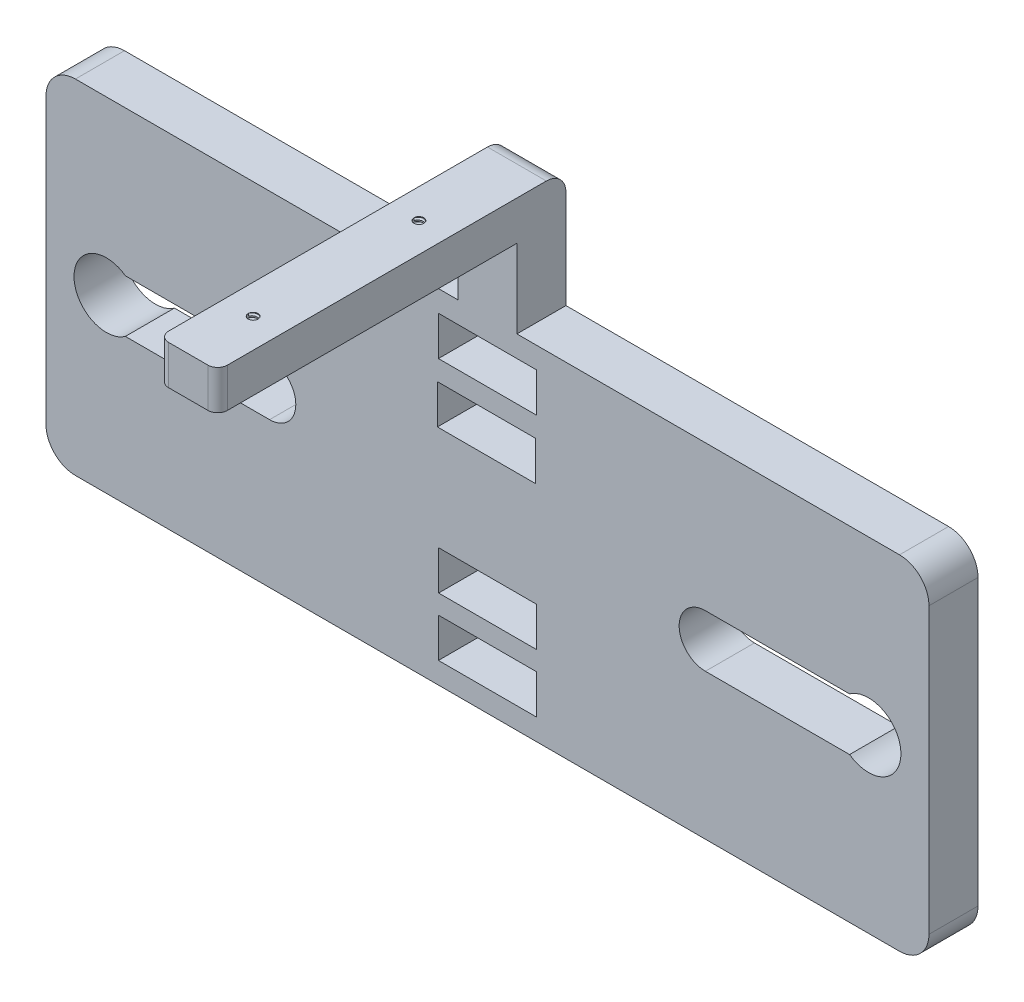
from build123d import *
from build123d.topology import SkipClean

# Parameters (mm, degrees)
SKETCH1_W           = 10
SKETCH1_H           = 4
BOSS_EXTRUDE1_DEPTH = 5
FILLET1_R           = 3
SKETCH9_W           = 6
SKETCH9_H           = 5
BOSS_EXTRUDE3_DEPTH = 12
SKETCH11_W          = 6
SKETCH11_H          = 4
BOSS_EXTRUDE4_DEPTH = 30.5
SKETCH12_R          = 0.5
CUT_EXTRUDE2_DEPTH  = 10.5
THREAD3_PITCH       = 0.4
THREAD4_PITCH       = 0.4
FILLET3_R           = 2
FILLET4_R           = 1


with BuildPart() as part:
    # Sketch1 → Boss-Extrude1 (new body)
    with BuildSketch(Plane.XY):
        Polygon((-33.103761, 0), (0, 0), (56.896239, 0), (56.896239, 35), (-33.103761, 35), align=None)
        with Locations((11.896239, 4.176333)):
            Rectangle(SKETCH1_W, SKETCH1_H, mode=Mode.SUBTRACT)
        with Locations((11.917367, 10.136034)):
            Rectangle(SKETCH1_W, SKETCH1_H, mode=Mode.SUBTRACT)
        with BuildLine():
            ThreePointArc((-25.014766, 14.825), (-30.247219, 17.5), (-25.014766, 20.175))
            Line((-25.014766, 20.175), (-10.315268, 20.175))
            ThreePointArc((-10.315268, 20.175), (-7.640268, 17.5), (-10.315268, 14.825))
            Line((-10.315268, 14.825), (-25.014766, 14.825))
        make_face(mode=Mode.SUBTRACT)
        with Locations((11.792626, 24.734904)):
            Rectangle(SKETCH1_W, SKETCH1_H, mode=Mode.SUBTRACT)
        with BuildLine():
            Line((34.107746, 20.175), (48.807244, 20.175))
            ThreePointArc((48.807244, 20.175), (52.241847, 20.43829), (54.039697, 17.5))
            ThreePointArc((54.039697, 17.5), (52.241847, 14.56171), (48.807244, 14.825))
            Line((48.807244, 14.825), (34.107746, 14.825))
            ThreePointArc((34.107746, 14.825), (31.432746, 17.5), (34.107746, 20.175))
        make_face(mode=Mode.SUBTRACT)
        with Locations((11.896239, 30.823667)):
            Rectangle(SKETCH1_W, SKETCH1_H, mode=Mode.SUBTRACT)
    extrude(amount=BOSS_EXTRUDE1_DEPTH)

    # Fillet1
    fillet1_edges = [part.edges().sort_by_distance(p)[0] for p in [
        (-33.103761, 35, 2.5),
        (56.896239, 35, 2.5),
        (56.896239, 0, 2.5),
        (-33.103761, 0, 2.5),
    ]]
    fillet(fillet1_edges, radius=FILLET1_R)

    # Sketch9 → Boss-Extrude3 (add)
    with BuildSketch(Plane(origin=(0, 35, 0), x_dir=(1, 0, 0), z_dir=(0, 1, 0))):
        with Locations((11.896239, -2.5)):
            Rectangle(SKETCH9_W, SKETCH9_H)
    extrude(amount=BOSS_EXTRUDE3_DEPTH)

    # Sketch11 → Boss-Extrude4 (add)
    with BuildSketch(Plane.XY.offset(5)):
        with Locations((11.896239, 45)):
            Rectangle(SKETCH11_W, SKETCH11_H)
    extrude(amount=BOSS_EXTRUDE4_DEPTH)

    # Sketch12 → Cut-Extrude2 (cut)
    with BuildSketch(Plane(origin=(0, 47, 0), x_dir=(1, 0, 0), z_dir=(0, 1, 0))):
        with Locations(Location((11.896239, -11.98434, 0), (0, 0, 270))):
            Circle(SKETCH12_R)
        with Locations(Location((11.896239, -28.88434, 0), (0, 0, 270))):
            Circle(SKETCH12_R)
    extrude(amount=-CUT_EXTRUDE2_DEPTH, mode=Mode.SUBTRACT)

    # Thread3: the profile of Thread Profile3 profile screwed along a right-hand helix of 25 turns, 6 arcs to a turn; built about Z, then put on its axis
    with SkipClean():  # the faces are left unmerged after this step: merging them gives an invalid solid
        thread3_z = Axis((0, 0, 0), (0, 0, 1))
        thread3_corners = [(0.4997, 0, -0.000173), (0.689443, 0, 0.109375), (0.689443, 0, 0.153125), (0.4997, 0, 0.262673)]
        with BuildLine(mode=Mode.PRIVATE) as thread3_profile:
            Line(thread3_corners[0], thread3_corners[1])
            Line(thread3_corners[1], thread3_corners[2])
            Line(thread3_corners[2], thread3_corners[3])
            Line(thread3_corners[3], thread3_corners[0])
        thread3_cap = Face(thread3_profile.wire())
        thread3_turn_angles = [0, 30, 60, 90, 120, 150, 180, 210, 240, 270, 300, 330, 360]
        thread3_turn_weights = [1, 0.8660254037844387, 1, 0.8660254037844387, 1, 0.8660254037844387, 1, 0.8660254037844387, 1, 0.8660254037844387, 1, 0.8660254037844387, 1]
        thread3_turn_rails = [Edge.make_bspline([Vector(p[0], p[1], 0).rotate(thread3_z, thread3_turn_angles[k]) / thread3_turn_weights[k] + Vector(0, 0, p[2] + THREAD3_PITCH * thread3_turn_angles[k] / 360) for k in range(13)], [0, 0, 0, 1, 1, 2, 2, 3, 3, 4, 4, 5, 5, 6, 6, 6], 2, thread3_turn_weights) for p in thread3_corners]
        thread3_turn_sides = [Face.make_surface_from_curves(thread3_turn_rails[p[0]], thread3_turn_rails[p[1]]) for p in [(0, 1), (1, 2), (2, 3), (3, 0)]]
        thread3 = Plane(origin=(11.896239, 47, 28.88434), x_dir=(-1, 0, 0), z_dir=(0, -1, 0)) * Solid(Shell([*[p.moved(Location((0, 0, THREAD3_PITCH * i))) for i in range(25) for p in thread3_turn_sides], thread3_cap, thread3_cap.rotate(thread3_z, 9000).moved(Location((0, 0, THREAD3_PITCH * 9000 / 360)))]))
        add(thread3, mode=Mode.SUBTRACT)

    # Thread4: the profile of Thread Profile4 profile screwed along a right-hand helix of 25 turns, 6 arcs to a turn; built about Z, then put on its axis
    with SkipClean():  # the faces are left unmerged after this step: merging them gives an invalid solid
        thread4_z = Axis((0, 0, 0), (0, 0, 1))
        thread4_corners = [(0.4997, 0, -0.000173), (0.689443, 0, 0.109375), (0.689443, 0, 0.153125), (0.4997, 0, 0.262673)]
        with BuildLine(mode=Mode.PRIVATE) as thread4_profile:
            Line(thread4_corners[0], thread4_corners[1])
            Line(thread4_corners[1], thread4_corners[2])
            Line(thread4_corners[2], thread4_corners[3])
            Line(thread4_corners[3], thread4_corners[0])
        thread4_cap = Face(thread4_profile.wire())
        thread4_turn_angles = [0, 30, 60, 90, 120, 150, 180, 210, 240, 270, 300, 330, 360]
        thread4_turn_weights = [1, 0.8660254037844387, 1, 0.8660254037844387, 1, 0.8660254037844387, 1, 0.8660254037844387, 1, 0.8660254037844387, 1, 0.8660254037844387, 1]
        thread4_turn_rails = [Edge.make_bspline([Vector(p[0], p[1], 0).rotate(thread4_z, thread4_turn_angles[k]) / thread4_turn_weights[k] + Vector(0, 0, p[2] + THREAD4_PITCH * thread4_turn_angles[k] / 360) for k in range(13)], [0, 0, 0, 1, 1, 2, 2, 3, 3, 4, 4, 5, 5, 6, 6, 6], 2, thread4_turn_weights) for p in thread4_corners]
        thread4_turn_sides = [Face.make_surface_from_curves(thread4_turn_rails[p[0]], thread4_turn_rails[p[1]]) for p in [(0, 1), (1, 2), (2, 3), (3, 0)]]
        thread4 = Plane(origin=(11.896239, 47, 11.98434), x_dir=(-1, 0, 0), z_dir=(0, -1, 0)) * Solid(Shell([*[p.moved(Location((0, 0, THREAD4_PITCH * i))) for i in range(25) for p in thread4_turn_sides], thread4_cap, thread4_cap.rotate(thread4_z, 9000).moved(Location((0, 0, THREAD4_PITCH * 9000 / 360)))]))
        add(thread4, mode=Mode.SUBTRACT)

    # Fillet3
    fillet3_edges = [part.edges().sort_by_distance(p)[0] for p in [
        (11.896239, 47, 0),
    ]]
    fillet(fillet3_edges, radius=FILLET3_R)

    # Fillet4
    fillet4_edges = [part.edges().sort_by_distance(p)[0] for p in [
        (8.896239, 45, 35.5),
        (14.896239, 45, 35.5),
    ]]
    fillet(fillet4_edges, radius=FILLET4_R)


solid = part.part
